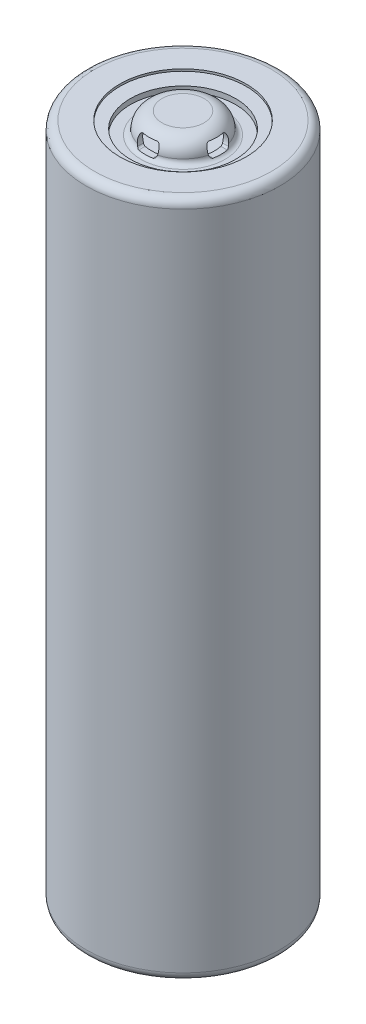
from build123d import *

# Parameters (mm, degrees)
SKETCH1_R                = 9
BOSS_EXTRUDE1_DEPTH      = 60
FILLET1_R                = 1
SKETCH2_R                = 7
BOSS_EXTRUDE2_DEPTH      = 2
FILLET2_R                = 1
FILLET3_R                = 1.5
FILLET4_R                = 0.5
FILLET5_R                = 0.5
SKETCH5_W                = 3
SKETCH5_H                = 0.5
FILLET6_R                = 0.8
FILLET7_R                = 0.3
CUT_EXTRUDE1_DEPTH       = 4
FILLET8_R                = 0.25
CIRPATTERN1_COUNT        = 4
FILLET8_OF_CIRPATTERN1_R = 0.25
FILLET9_R                = 0.8


# Some blends are built 0.0001 mm under size
with BuildPart() as part:
    # Sketch1 → Boss-Extrude1 (new body)
    with BuildSketch(Plane(origin=(0, 0, 0), x_dir=(1, 0, 0), z_dir=(0, 1, 0))):
        with Locations(Location((0, 0, 0), (0, 0, 270))):
            Circle(SKETCH1_R)
    extrude(amount=BOSS_EXTRUDE1_DEPTH)

    # Fillet1
    fillet1_edges = [part.edges().sort_by_distance(p)[0] for p in [
        (0, 0, -9),
        (0, 60, -9),
    ]]
    fillet(fillet1_edges, radius=FILLET1_R)

    # Sketch2 → Boss-Extrude2 (add)
    with BuildSketch(Plane(origin=(0, 60, 0), x_dir=(1, 0, 0), z_dir=(0, 1, 0))):
        with Locations(Location((0, 0, 0), (0, 0, 270))):
            Circle(SKETCH2_R)
    extrude(amount=BOSS_EXTRUDE2_DEPTH)

    # Fillet2
    fillet2_edges = [part.edges().sort_by_distance(p)[0] for p in [
        (0, 62, -7),
    ]]
    fillet(fillet2_edges, radius=FILLET2_R)


with BuildPart() as body_2:
    # Sketch4 → Revolve1 (revolve)
    with BuildSketch(Plane.XY, mode=Mode.PRIVATE) as revolve1_sk:
        Polygon((0, 65), (3.5, 65), (3.5, 63), (8, 63), (8, 62), (5, 62), (5, 62.5), (3, 62.5), (3, 64.5), (0, 64.5), align=None)
    revolve(revolve1_sk.sketch.rotate(Axis((0, 62, 0), (0, 1, 0)), 90), axis=Axis((0, 62, 0), (0, 1, 0)))

    # Fillet3
    fillet3_edges = [body_2.edges().sort_by_distance(p)[0] for p in [
        (0, 65, 3.5),
    ]]
    fillet(fillet3_edges, radius=FILLET3_R)

    # Fillet4
    fillet4_edges = [body_2.edges().sort_by_distance(p)[0] for p in [
        (0, 63, 3.5),
    ]]
    fillet(fillet4_edges, radius=FILLET4_R - 0.0001)  # a hair under: the kernel refuses the full size

    # Fillet5
    fillet5_edges = [body_2.edges().sort_by_distance(p)[0] for p in [
        (0, 63, 8),
        (0, 62, 8),
    ]]
    fillet(fillet5_edges, radius=FILLET5_R - 0.0001)  # a hair under: the kernel refuses the full size

    # Sketch7 → Cut-Extrude1 (cut)
    with BuildSketch(Plane(origin=(0, 0, 0), x_dir=(0, 0, -1), z_dir=(1, 0, 0))):
        with BuildLine():
            Line((-0.8, 63.2), (0.8, 63.2))
            ThreePointArc((0.8, 63.2), (1, 63.8), (0.8, 64.4))
            Line((0.8, 64.4), (-0.8, 64.4))
            ThreePointArc((-0.8, 64.4), (-1, 63.8), (-0.8, 63.2))
        make_face()
    cut_extrude1 = extrude(amount=-CUT_EXTRUDE1_DEPTH, mode=Mode.SUBTRACT)

    # Fillet8
    fillet8_edges = [body_2.edges().sort_by_distance(p)[0] for p in [
        (-2.994876568, 64.4, 0.8),
        (-2.994876568, 64.4, -0.8),
        (-3.200650467, 63.2, -0.8),
        (-3.200650467, 63.2, 0.8),
    ]]
    fillet(fillet8_edges, radius=FILLET8_R)

    # CirPattern1: Cut-Extrude1 ×4 about axis
    cirpattern1_axis = Axis((0, 63.5, 0), (0, 1, 0))
    for i in range(1, CIRPATTERN1_COUNT):
        add(cut_extrude1.rotate(cirpattern1_axis, i * 360 / CIRPATTERN1_COUNT), mode=Mode.SUBTRACT)

    # Fillet8 of CirPattern1
    fillet8_of_cirpattern1_edges = [body_2.edges().sort_by_distance(p)[0] for p in [
        (0.8, 64.4, 2.994876568),
        (-0.8, 64.4, 2.994876568),
        (-0.8, 63.2, 3.200650467),
        (0.8, 63.2, 3.200650467),
        (2.994876568, 64.4, -0.8),
        (2.994876568, 64.4, 0.8),
        (3.200650467, 63.2, 0.8),
        (3.200650467, 63.2, -0.8),
        (-0.8, 64.4, -2.994876568),
        (0.8, 64.4, -2.994876568),
        (0.8, 63.2, -3.200650467),
        (-0.8, 63.2, -3.200650467),
    ]]
    fillet(fillet8_of_cirpattern1_edges, radius=FILLET8_OF_CIRPATTERN1_R)


with BuildPart() as body_3:
    # Sketch5 → Revolve2 isolation (revolve)
    with BuildSketch(Plane.XY, mode=Mode.PRIVATE) as revolve2_isolation_sk:
        with Locations((6.5, 63.25)):
            Rectangle(SKETCH5_W, SKETCH5_H)
    revolve(revolve2_isolation_sk.sketch.rotate(Axis((0, 63, 0), (0, 1, 0)), 90), axis=Axis((0, 63, 0), (0, 1, 0)))


with BuildPart() as body_4:
    # Sketch6 → Revolve4 crimp (revolve)
    with BuildSketch(Plane(origin=(0, 0, 0), x_dir=(0, 0, -1), z_dir=(1, 0, 0))):
        Polygon((7, 62), (7, 61), (8.8, 61), (8.8, 64), (7, 64), (7, 63.5), (8.5, 63.5), (8.5, 61.3), (7.3, 61.3), (7.3, 62), align=None)
    revolve(axis=Axis((0, 0, 0), (0, 1, 0)))

    # Fillet6
    # the kernel refuses this fillet: 0.8 mm, written as the material it takes off along each edge
    with BuildSketch(Plane(origin=(0, 61, 0), x_dir=(0, 0, -1), z_dir=(1, 0, 0))) as fillet6_piece_1:
        with BuildLine():
            CenterArc((8.8 - FILLET6_R, FILLET6_R), FILLET6_R, 270, 90)
            Line((8.8, FILLET6_R), (8.8 + FILLET6_R * 0.02, FILLET6_R))
            Line((8.8 + FILLET6_R * 0.02, FILLET6_R), (8.8 + FILLET6_R * 0.02, -FILLET6_R * 0.02))
            Line((8.8 + FILLET6_R * 0.02, -FILLET6_R * 0.02), (8.8 - FILLET6_R, -FILLET6_R * 0.02))
            Line((8.8 - FILLET6_R, -FILLET6_R * 0.02), (8.8 - FILLET6_R, 0))
        make_face()
    revolve(axis=Axis((0, 61, 0), (0, 1, 0)), mode=Mode.SUBTRACT)
    with BuildSketch(Plane(origin=(0, 64, 0), x_dir=(0, 0, -1), z_dir=(1, 0, 0))) as fillet6_piece_2:
        with BuildLine():
            CenterArc((8.8 - FILLET6_R, -FILLET6_R), FILLET6_R, 0, 90)
            Line((8.8 - FILLET6_R, 0), (8.8 - FILLET6_R, FILLET6_R * 0.02))
            Line((8.8 - FILLET6_R, FILLET6_R * 0.02), (8.8 + FILLET6_R * 0.02, FILLET6_R * 0.02))
            Line((8.8 + FILLET6_R * 0.02, FILLET6_R * 0.02), (8.8 + FILLET6_R * 0.02, -FILLET6_R))
            Line((8.8 + FILLET6_R * 0.02, -FILLET6_R), (8.8, -FILLET6_R))
        make_face()
    revolve(axis=Axis((0, 64, 0), (0, 1, 0)), mode=Mode.SUBTRACT)
    with BuildSketch(Plane(origin=(0, 64, 0), x_dir=(0, 0, -1), z_dir=(1, 0, 0))) as fillet6_piece_3:
        with BuildLine():
            CenterArc((7.741619849, -0.8), FILLET6_R, 90, 67.975687163)
            Line((7, -0.5), (6.985167603, -0.494))
            ThreePointArc((6.985167603, -0.494), (6.984, -0.25), (6.984, 0))
            Line((6.984, 0), (7, 0.016))
            Line((7, 0.016), (7.741619849, 0.016))
            Line((7.741619849, 0.016), (7.741619849, 0))
        make_face()
    revolve(axis=Axis((0, 64, 0), (0, 1, 0)), mode=Mode.SUBTRACT)

    # Fillet7
    fillet7_edges = [body_4.edges().sort_by_distance(p)[0] for p in [
        (0, 61, 7),
    ]]
    fillet(fillet7_edges, radius=FILLET7_R)


with BuildPart() as body_5:
    # Sketch8 → Revolve5 wrap (revolve)
    with BuildSketch(Plane(origin=(0, 0, 0), x_dir=(0, 0, -1), z_dir=(1, 0, 0)), mode=Mode.PRIVATE) as revolve5_wrap_sk:
        Polygon((6, 64), (9, 64), (9, 0), (6, 0), (6, -0.2), (9.2, -0.2), (9.2, 64.2), (6, 64.2), align=None)
    revolve(revolve5_wrap_sk.sketch.rotate(Axis((0, 65, 0), (0, -1, 0)), 180), axis=Axis((0, 65, 0), (0, -1, 0)))

    # Fillet9
    fillet9_edges = [body_5.edges().sort_by_distance(p)[0] for p in [
        (0, 64.2, -9.2),
        (0, -0.2, -9.2),
        (0, 0, -9),
        (0, 64, -9),
    ]]
    fillet(fillet9_edges, radius=FILLET9_R)


solid = Compound([part.part, body_2.part, body_3.part, body_4.part, body_5.part])
